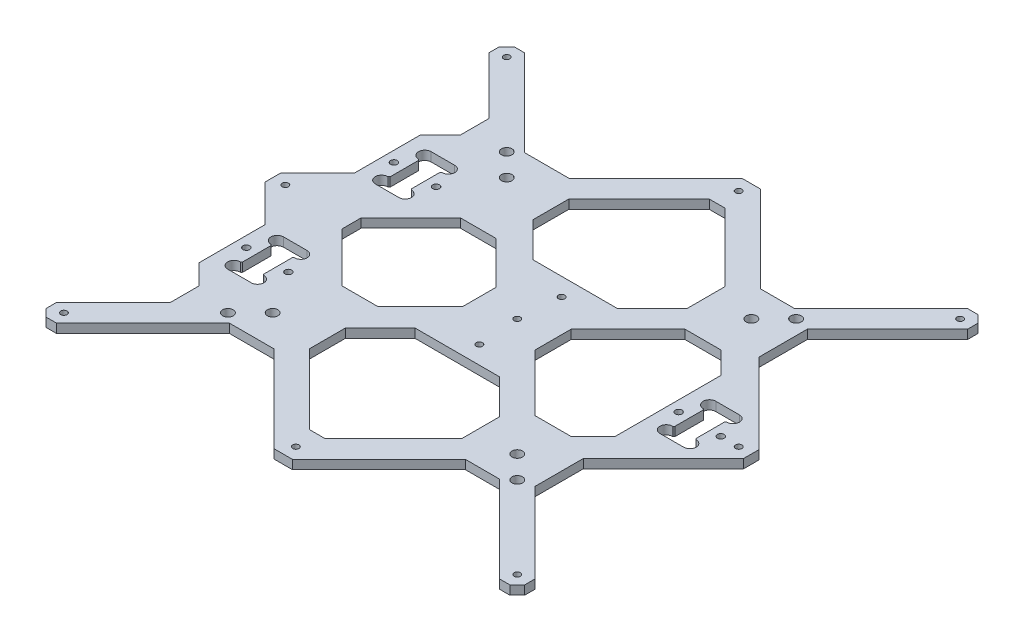
from build123d import *

# Parameters (mm, degrees)
SKETCH2_R            = 1.5
SKETCH2_R_2          = 1.6
BOSS_EXTRUDE2_DEPTH  = 4.25
SKETCH4_R            = 2.5
HOLES_TO_DRILL_DEPTH = 416.108494854


with BuildPart() as part:
    # Sketch2 → Boss-Extrude2 (new body)
    with BuildSketch(Plane(origin=(0, 0, 0), x_dir=(1, 0, 0), z_dir=(0, 1, 0))):
        Polygon((225.400116, 255), (184.400116, 296), (175.599884, 296), (134.599884, 255), (113.485281374, 255), (72.485281374, 296), (67.514830223, 296), (64, 292.485169777), (64, 287.514718626), (91, 260.514718626), (91, 247), (81.5, 237.5), (81.5, 206.239105), (64, 188.739105), (64, 181.260895), (81.5, 163.760895), (81.5, 132.5), (91, 123), (91, 109.485281374), (64, 82.485281374), (64, 77.514830223), (67.514830223, 74), (72.485281374, 74), (113.485281374, 115), (134.599884, 115), (175.599884, 74), (184.400116, 74), (225.400116, 115), (241.514718626, 115), (282.514718626, 74), (287.485169777, 74), (291, 77.514830223), (291, 82.485281374), (253, 120.485281374), (253, 143.333039), (291, 181.333039), (291, 188.666961), (253, 226.666961), (253, 249.514718626), (291, 287.514718626), (291, 292.485169777), (287.485169777, 296), (282.514718626, 296), (241.514718626, 255), align=None)
        with Locations((70, 80)):
            Circle(SKETCH2_R, mode=Mode.SUBTRACT)
        with Locations((180, 80)):
            Circle(SKETCH2_R, mode=Mode.SUBTRACT)
        with Locations((86.5, 150)):
            Circle(SKETCH2_R_2, mode=Mode.SUBTRACT)
        with Locations((70, 185)):
            Circle(SKETCH2_R, mode=Mode.SUBTRACT)
        Polygon((176.317383, 90.266846), (143, 123.584229), (143, 140.433686), (159.566314, 157), (199.51474, 157), (216, 140.51474), (216, 122.570419884), (183.682617, 90.253036884), align=None, mode=Mode.SUBTRACT)
        with BuildLine():
            Line((102.000000013, 157.25), (101.500000013, 156.75))
            Line((101.500000013, 156.75), (101.500000013, 143.25))
            Line((101.500000013, 143.25), (102.000000013, 142.75))
            Line((102.000000013, 142.75), (102.100000157, 142.75))
            ThreePointArc((102.100000157, 142.75), (105.1, 139.75), (102.100000157, 136.75))
            Line((102.100000157, 136.75), (90.899999843, 136.75))
            ThreePointArc((90.899999843, 136.75), (87.9, 139.75), (90.899999843, 142.75))
            Line((90.899999843, 142.75), (90.999999987, 142.75))
            Line((90.999999987, 142.75), (91.499999987, 143.25))
            Line((91.499999987, 143.25), (91.499999987, 156.75))
            Line((91.499999987, 156.75), (90.999999987, 157.25))
            Line((90.999999987, 157.25), (90.899999843, 157.25))
            ThreePointArc((90.899999843, 157.25), (87.9, 160.25), (90.899999843, 163.25))
            Line((90.899999843, 163.25), (102.100000157, 163.25))
            ThreePointArc((102.100000157, 163.25), (105.100000157, 160.25), (102.100000157, 157.25))
            Line((102.100000157, 157.25), (102.000000013, 157.25))
        make_face(mode=Mode.SUBTRACT)
        with Locations((106.5, 150)):
            Circle(SKETCH2_R_2, mode=Mode.SUBTRACT)
        with Locations((181.5, 165.5)):
            Circle(SKETCH2_R, mode=Mode.SUBTRACT)
        with Locations((285, 80)):
            Circle(SKETCH2_R, mode=Mode.SUBTRACT)
        with Locations((86.5, 220)):
            Circle(SKETCH2_R_2, mode=Mode.SUBTRACT)
        Polygon((162, 192.97703218), (162, 177.02296782), (141.97703218, 157), (124.999970007, 157), (101.5, 180.5), (101.5, 189.5), (124.999970007, 213), (141.97703218, 213), align=None, mode=Mode.SUBTRACT)
        with BuildLine():
            Line((102.000000013, 227.25), (101.500000013, 226.75))
            Line((101.500000013, 226.75), (101.500000013, 213.25))
            Line((101.500000013, 213.25), (102.000000013, 212.75))
            Line((102.000000013, 212.75), (102.100000157, 212.75))
            ThreePointArc((102.100000157, 212.75), (105.1, 209.75), (102.100000157, 206.75))
            Line((102.100000157, 206.75), (90.899999843, 206.75))
            ThreePointArc((90.899999843, 206.75), (87.9, 209.75), (90.899999843, 212.75))
            Line((90.899999843, 212.75), (90.999999987, 212.75))
            Line((90.999999987, 212.75), (91.499999987, 213.25))
            Line((91.499999987, 213.25), (91.499999987, 226.75))
            Line((91.499999987, 226.75), (90.999999987, 227.25))
            Line((90.999999987, 227.25), (90.899999843, 227.25))
            ThreePointArc((90.899999843, 227.25), (87.9, 230.25), (90.899999843, 233.25))
            Line((90.899999843, 233.25), (102.100000157, 233.25))
            ThreePointArc((102.100000157, 233.25), (105.100000157, 230.25), (102.100000157, 227.25))
            Line((102.100000157, 227.25), (102.000000013, 227.25))
        make_face(mode=Mode.SUBTRACT)
        with Locations((106.5, 220)):
            Circle(SKETCH2_R_2, mode=Mode.SUBTRACT)
        with Locations((180, 185)):
            Circle(SKETCH2_R, mode=Mode.SUBTRACT)
        with Locations((181.5, 204.5)):
            Circle(SKETCH2_R, mode=Mode.SUBTRACT)
        Polygon((143, 229.566314), (143, 246.415771), (176.317383, 279.733154), (183.682617, 279.746963116), (216, 247.429580116), (216, 229.48526), (199.51474, 213), (159.566314, 213), align=None, mode=Mode.SUBTRACT)
        with Locations((70, 290)):
            Circle(SKETCH2_R, mode=Mode.SUBTRACT)
        with Locations((180, 290)):
            Circle(SKETCH2_R, mode=Mode.SUBTRACT)
        Polygon((240.98529, 220.529449), (251.5, 210.014709), (251.5, 159.985291), (240.98529, 149.470551), (224.014709, 149.470551), (197, 176.48526), (197, 193.51474), (224.014709, 220.529449), align=None, mode=Mode.SUBTRACT)
        with Locations((256.5, 185)):
            Circle(SKETCH2_R_2, mode=Mode.SUBTRACT)
        with BuildLine():
            Line((272.000000013, 192.25), (271.500000013, 191.75))
            Line((271.500000013, 191.75), (271.500000013, 178.25))
            Line((271.500000013, 178.25), (272.000000013, 177.75))
            Line((272.000000013, 177.75), (272.100000157, 177.75))
            ThreePointArc((272.100000157, 177.75), (275.100000157, 174.75), (272.100000157, 171.75))
            Line((272.100000157, 171.75), (260.899999843, 171.75))
            ThreePointArc((260.899999843, 171.75), (257.9, 174.75), (260.899999843, 177.75))
            Line((260.899999843, 177.75), (260.999999987, 177.75))
            Line((260.999999987, 177.75), (261.499999987, 178.25))
            Line((261.499999987, 178.25), (261.499999987, 191.75))
            Line((261.499999987, 191.75), (260.999999987, 192.25))
            Line((260.999999987, 192.25), (260.899999843, 192.25))
            ThreePointArc((260.899999843, 192.25), (257.9, 195.25), (260.899999843, 198.25))
            Line((260.899999843, 198.25), (272.100000157, 198.25))
            ThreePointArc((272.100000157, 198.25), (275.100000157, 195.25), (272.100000157, 192.25))
            Line((272.100000157, 192.25), (272.000000013, 192.25))
        make_face(mode=Mode.SUBTRACT)
        with Locations((276.5, 185)):
            Circle(SKETCH2_R_2, mode=Mode.SUBTRACT)
        with Locations((285, 185)):
            Circle(SKETCH2_R, mode=Mode.SUBTRACT)
        with Locations((285, 290)):
            Circle(SKETCH2_R, mode=Mode.SUBTRACT)
    extrude(amount=BOSS_EXTRUDE2_DEPTH)

    # Sketch4 → Holes-to-drill (cut, through all)
    with BuildSketch(Plane(origin=(0, 4.25, 0), x_dir=(1, 0, 0), z_dir=(0, 1, 0))):
        with Locations((119.497530482, 129.497530482)):
            Circle(SKETCH4_R)
        with Locations((108.890928764, 118.890928764)):
            Circle(SKETCH4_R)
        with Locations((108.890928764, 251.109071236)):
            Circle(SKETCH4_R)
        with Locations((119.497530482, 240.502469518)):
            Circle(SKETCH4_R)
        with Locations((235.502469518, 240.502469518)):
            Circle(SKETCH4_R)
        with Locations((246.109071236, 251.109071236)):
            Circle(SKETCH4_R)
        with Locations((235.502469518, 129.497530482)):
            Circle(SKETCH4_R)
        with Locations((246.109071236, 118.890928764)):
            Circle(SKETCH4_R)
    extrude(amount=-HOLES_TO_DRILL_DEPTH, mode=Mode.SUBTRACT)


solid = part.part
